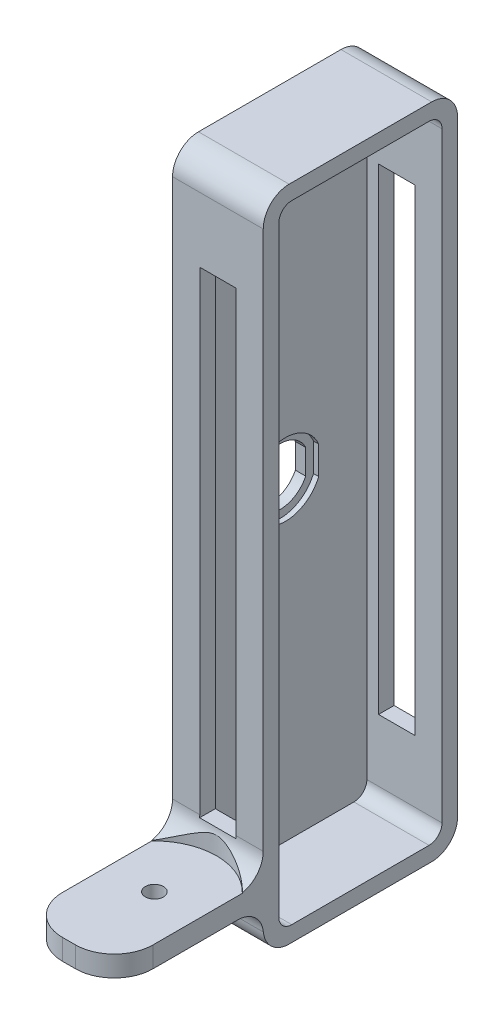
from build123d import *

# Parameters (mm, degrees)
SKETCH3_W                 = 75
SKETCH3_H                 = 254
BOSS_EXTRUDE2_DEPTH       = 35
SHELL2_T                  = -6
CUT_EXTRUDE1_DEPTH        = 2
CUT_EXTRUDE2_DEPTH        = 137.000919115
SKETCH6_W                 = 14
SKETCH6_H                 = 184
CUT_EXTRUDE3_DEPTH        = 152.58825812
FILLET1_R                 = 10
FILLET2_R                 = 5
SKETCH12_W                = 57.5
SKETCH12_H                = 8
BOSS_EXTRUDE4_DEPTH       = 35
FILLET5_R                 = 10
FILLET6_R                 = 15
M8X1_0_TAPPED_HOLE1_D     = 7
M8X1_0_TAPPED_HOLE1_DEPTH = 8
M8X1_0_TAPPED_HOLE1_TIP   = 2.103012167
SKETCH16_R                = 24
CUT_EXTRUDE4_DEPTH        = 91


with BuildPart() as part:
    # Sketch3 → Boss-Extrude2 (new body)
    with BuildSketch(Plane(origin=(0, 0, 0), x_dir=(0, 0, -1), z_dir=(1, 0, 0))):
        Rectangle(SKETCH3_W, SKETCH3_H)
    extrude(amount=BOSS_EXTRUDE2_DEPTH)

    # Shell2
    shell2_openings = [part.faces().sort_by_distance(p)[0] for p in [
        (35, 0, 0),
    ]]
    offset(amount=SHELL2_T, openings=shell2_openings, kind=Kind.INTERSECTION)

    # Sketch4 → Cut-Extrude1 (cut)
    with BuildSketch(Plane(origin=(6, 0, 0), x_dir=(0, 0, -1), z_dir=(1, 0, 0))):
        with BuildLine():
            Line((12.9, -5.439669108), (12.9, 5.439669108))
            ThreePointArc((12.9, 5.439669108), (0.363761531, 13.9952734), (-12.6, 6.102458521))
            Line((-12.6, 6.102458521), (-12.6, -6.102458521))
            ThreePointArc((-12.6, -6.102458521), (0.363761531, -13.9952734), (12.9, -5.439669108))
        make_face()
    extrude(amount=-CUT_EXTRUDE1_DEPTH, mode=Mode.SUBTRACT)

    # Sketch5 → Cut-Extrude2 (cut, through all)
    with BuildSketch(Plane(origin=(4, 0, 0), x_dir=(0, 0, -1), z_dir=(1, 0, 0))):
        with BuildLine():
            Line((9.9, -4.794788838), (9.9, 4.794788838))
            ThreePointArc((9.9, 4.794788838), (0, 11), (-9.9, 4.794788838))
            Line((-9.9, 4.794788838), (-9.9, -4.794788838))
            ThreePointArc((-9.9, -4.794788838), (0, -11), (9.9, -4.794788838))
        make_face()
    extrude(amount=-CUT_EXTRUDE2_DEPTH, mode=Mode.SUBTRACT)

    # Sketch6 → Cut-Extrude3 (cut, through all)
    with BuildSketch(Plane.XY.offset(37.5)):
        with Locations((17.5, 0)):
            Rectangle(SKETCH6_W, SKETCH6_H)
    extrude(amount=-CUT_EXTRUDE3_DEPTH, mode=Mode.SUBTRACT)

    # Fillet1
    fillet1_edges = [part.edges().sort_by_distance(p)[0] for p in [
        (17.5, -127, -37.5),
        (17.5, -127, 37.5),
        (17.5, 127, 37.5),
        (17.5, 127, -37.5),
    ]]
    fillet(fillet1_edges, radius=FILLET1_R)

    # Fillet2
    fillet2_edges = [part.edges().sort_by_distance(p)[0] for p in [
        (20.5, -121, -31.5),
        (20.5, 121, -31.5),
        (20.5, 121, 31.5),
        (20.5, -121, 31.5),
    ]]
    fillet(fillet2_edges, radius=FILLET2_R)

    # Sketch12 → Boss-Extrude4 (add)
    with BuildSketch(Plane(origin=(35, 0, 0), x_dir=(0, 0, -1), z_dir=(1, 0, 0))):
        with Locations((-66.25, -105)):
            Rectangle(SKETCH12_W, SKETCH12_H)
    extrude(amount=-BOSS_EXTRUDE4_DEPTH)

    # Fillet5
    # the kernel refuses this fillet: 10 mm, written as the material it adds along each edge
    with BuildSketch(Plane(origin=(35, -109, 37.5), x_dir=(0, -0.9999844906159053, -0.0055694279462415305), z_dir=(-1, 0, 0))) as fillet5_piece_1:
        with BuildLine():
            CenterArc((9.944708969, 9.955289483), FILLET5_R, 180.319106365, 84.260829523)
            Line((-0.055135937, 9.899595203), (-1.055120428, 9.894025775))
            Line((-1.055120428, 9.894025775), (-0.999984491, -0.005569428))
            Line((-0.999984491, -0.005569428), (0.005569428, -0.999984491))
            ThreePointArc((0.005569428, -0.999984491), (8.005445353, -0.955429067), (8.905682648, -0.995528948))
            Line((8.905682648, -0.995528948), (9.000139587, 0))
        make_face()
    extrude(amount=35)
    with BuildSketch(Plane(origin=(35, -101, 37.5), x_dir=(0, 1, 0), z_dir=(-1, 0, 0))) as fillet5_piece_2_section:
        with BuildLine():
            CenterArc((FILLET5_R, -FILLET5_R), FILLET5_R, 90, 90)
            Line((0, -FILLET5_R), (0, 0))
            Line((0, 0), (FILLET5_R, 0))
        make_face()
    fillet5_piece_2 = extrude(amount=35, mode=Mode.PRIVATE)
    fillet5_piece_2 = split(fillet5_piece_2, bisect_by=Plane(origin=(29.75, -92, 37.408860849), z_dir=(0, 1, 0)), keep=Keep.TOP, mode=Mode.PRIVATE)
    fillet5_piece_2 = split(fillet5_piece_2, bisect_by=Plane(origin=(24.5, -91.519267155, 37.408860849), z_dir=(1, 0, 0)), keep=Keep.TOP, mode=Mode.PRIVATE)
    add(fillet5_piece_2)
    with BuildSketch(Plane(origin=(35, -101, 37.5), x_dir=(0, 1, 0), z_dir=(-1, 0, 0))) as fillet5_piece_3_section:
        with BuildLine():
            CenterArc((FILLET5_R, -FILLET5_R), FILLET5_R, 90, 90)
            Line((0, -FILLET5_R), (0, 0))
            Line((0, 0), (FILLET5_R, 0))
        make_face()
    fillet5_piece_3 = extrude(amount=35, mode=Mode.PRIVATE)
    fillet5_piece_3 = split(fillet5_piece_3, bisect_by=Plane(origin=(29.75, -92, 39.784135406), z_dir=(0, -1, 0)), keep=Keep.TOP, mode=Mode.PRIVATE)
    fillet5_piece_3 = split(fillet5_piece_3, bisect_by=Plane(origin=(24.5, -98.797900168, 39.784135406), z_dir=(1, 0, 0)), keep=Keep.TOP, mode=Mode.PRIVATE)
    add(fillet5_piece_3)
    with BuildSketch(Plane(origin=(35, -101, 37.5), x_dir=(0, 1, 0), z_dir=(-1, 0, 0))) as fillet5_piece_4_section:
        with BuildLine():
            CenterArc((FILLET5_R, -FILLET5_R), FILLET5_R, 90, 90)
            Line((0, -FILLET5_R), (0, 0))
            Line((0, 0), (FILLET5_R, 0))
        make_face()
    fillet5_piece_4 = extrude(amount=35, mode=Mode.PRIVATE)
    fillet5_piece_4 = split(fillet5_piece_4, bisect_by=Plane(origin=(10.5, -98.797900168, 39.784135406), z_dir=(1, 0, 0)), keep=Keep.TOP, mode=Mode.PRIVATE)
    fillet5_piece_4 = split(fillet5_piece_4, bisect_by=Plane(origin=(17.5, -92, 39.784135406), z_dir=(0, -1, 0)), keep=Keep.TOP, mode=Mode.PRIVATE)
    fillet5_piece_4 = split(fillet5_piece_4, bisect_by=Plane(origin=(24.5, -98.797900168, 39.784135406), z_dir=(-1, 0, 0)), keep=Keep.TOP, mode=Mode.PRIVATE)
    add(fillet5_piece_4)
    with BuildSketch(Plane(origin=(35, -101, 37.5), x_dir=(0, 1, 0), z_dir=(-1, 0, 0))) as fillet5_piece_5_section:
        with BuildLine():
            CenterArc((FILLET5_R, -FILLET5_R), FILLET5_R, 90, 90)
            Line((0, -FILLET5_R), (0, 0))
            Line((0, 0), (FILLET5_R, 0))
        make_face()
    fillet5_piece_5 = extrude(amount=35, mode=Mode.PRIVATE)
    fillet5_piece_5 = split(fillet5_piece_5, bisect_by=Plane(origin=(10.5, -91.519267155, 37.408860849), z_dir=(-1, 0, 0)), keep=Keep.TOP, mode=Mode.PRIVATE)
    fillet5_piece_5 = split(fillet5_piece_5, bisect_by=Plane(origin=(5.25, -92, 37.408860849), z_dir=(0, 1, 0)), keep=Keep.TOP, mode=Mode.PRIVATE)
    add(fillet5_piece_5)
    with BuildSketch(Plane(origin=(35, -101, 37.5), x_dir=(0, 1, 0), z_dir=(-1, 0, 0))) as fillet5_piece_6_section:
        with BuildLine():
            CenterArc((FILLET5_R, -FILLET5_R), FILLET5_R, 90, 90)
            Line((0, -FILLET5_R), (0, 0))
            Line((0, 0), (FILLET5_R, 0))
        make_face()
    fillet5_piece_6 = extrude(amount=35, mode=Mode.PRIVATE)
    fillet5_piece_6 = split(fillet5_piece_6, bisect_by=Plane(origin=(10.5, -98.797900168, 39.784135406), z_dir=(-1, 0, 0)), keep=Keep.TOP, mode=Mode.PRIVATE)
    fillet5_piece_6 = split(fillet5_piece_6, bisect_by=Plane(origin=(5.25, -92, 39.784135406), z_dir=(0, -1, 0)), keep=Keep.TOP, mode=Mode.PRIVATE)
    add(fillet5_piece_6)

    # Fillet6
    fillet6_edges = [part.edges().sort_by_distance(p)[0] for p in [
        (35, -105, 95),
        (0, -105, 95),
    ]]
    fillet(fillet6_edges, radius=FILLET6_R)

    # M8x1.0 Tapped Hole1
    with Locations(Plane(origin=(17.5, -101, 62), x_dir=(0, 0, 1), z_dir=(0, 1, 0))):
        with Locations((0, 0)):
            Hole(M8X1_0_TAPPED_HOLE1_D / 2, depth=M8X1_0_TAPPED_HOLE1_DEPTH)
            with Locations((0, 0, -(M8X1_0_TAPPED_HOLE1_DEPTH + M8X1_0_TAPPED_HOLE1_TIP / 2))):  # 118° drill point
                Cone(0, M8X1_0_TAPPED_HOLE1_D / 2, M8X1_0_TAPPED_HOLE1_TIP, mode=Mode.SUBTRACT)

    # Sketch16 → Cut-Extrude4 (cut)
    with BuildSketch(Plane(origin=(0, -101, 0), x_dir=(1, 0, 0), z_dir=(0, 1, 0))):
        with Locations((17.5, -62)):
            Circle(SKETCH16_R)
    extrude(amount=CUT_EXTRUDE4_DEPTH, mode=Mode.SUBTRACT)


solid = part.part
